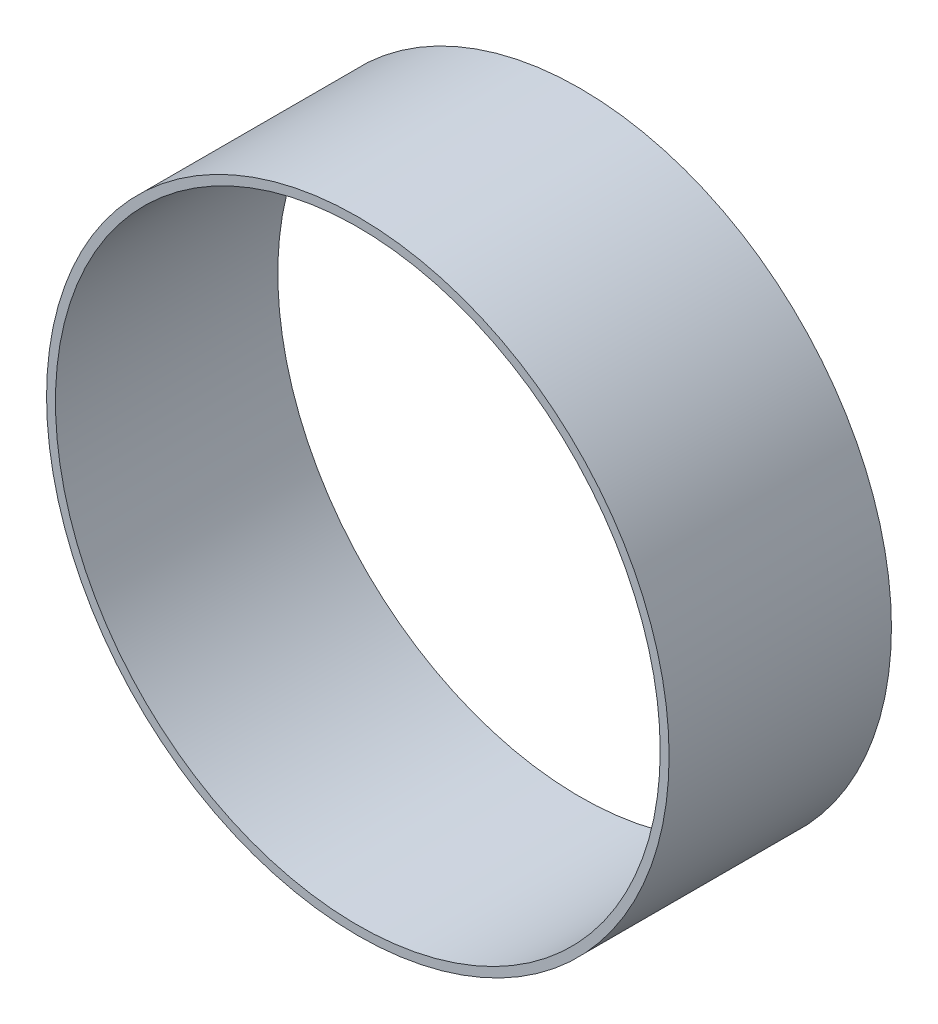
from build123d import *

# Parameters (mm, degrees)
SKETCH_1_W = 50
SKETCH_1_H = 2


with BuildPart() as part:
    # Эскиз1 → Повернуть1 (revolve)
    with BuildSketch(Plane(origin=(0, 0, 0), x_dir=(0, 0, -1), z_dir=(1, 0, 0))):
        with Locations((25, 69)):
            Rectangle(SKETCH_1_W, SKETCH_1_H)
    revolve(axis=Axis((0, 0, 0), (0, 0, -1)))


solid = part.part
